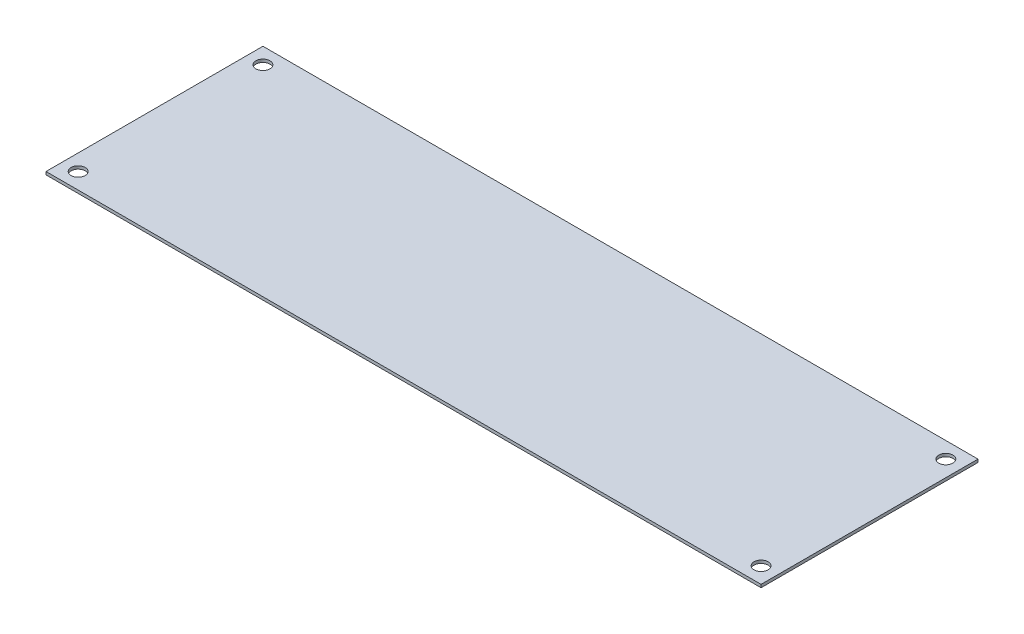
from build123d import *

# Parameters (mm, degrees)
SKETCH1_W          = 178
SKETCH1_H          = 54
SKETCH1_R          = 1.75
BASE_FLANGE1_DEPTH = 0.7366


# Sheet-metal steps are written as plain solids
with BuildPart() as part:
    # Sketch1 → Base-Flange1 (new body)
    with BuildSketch(Plane(origin=(0, 0, 0), x_dir=(1, 0, 0), z_dir=(0, 1, 0))):
        Rectangle(SKETCH1_W, SKETCH1_H)
        with Locations(Location((85, 23, 0), (0, 0, 270))):
            Circle(SKETCH1_R, mode=Mode.SUBTRACT)
        with Locations(Location((85, -23, 0), (0, 0, 270))):
            Circle(SKETCH1_R, mode=Mode.SUBTRACT)
        with Locations(Location((-85, -23, 0), (0, 0, 270))):
            Circle(SKETCH1_R, mode=Mode.SUBTRACT)
        with Locations(Location((-85, 23, 0), (0, 0, 270))):
            Circle(SKETCH1_R, mode=Mode.SUBTRACT)
    extrude(amount=-BASE_FLANGE1_DEPTH)


solid = part.part
